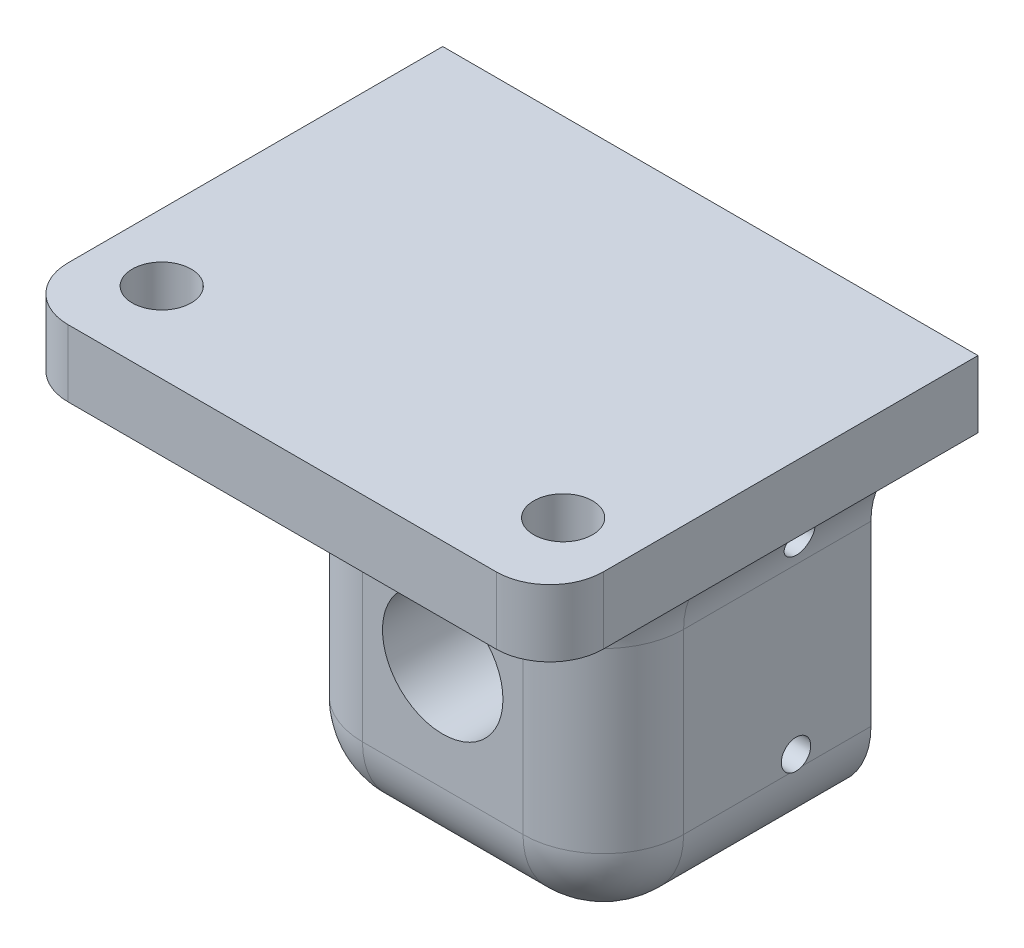
from build123d import *

# Parameters (mm, degrees)
ESQUISSE1_W                  = 40
ESQUISSE1_H                  = 34
BOSS_EXTRU_1_DEPTH           = 20
ESQUISSE2_W                  = 40
ESQUISSE2_H                  = 5
BOSS_EXTRU_3_DEPTH           = 20
ESQUISSE4_R                  = 4.5
ENL_V_MAT_EXTRU_1_DEPTH      = 34
ESQUISSE5_R                  = 8.1
ENL_V_MAT_EXTRU_2_DEPTH      = 12
ENL_V_MAT_EXTRU_3_DEPTH      = 34
CONG_3_R                     = 6
CONG_4_R                     = 6
ENL_V_MAT_EXTRU_4_DEPTH      = 54.972215074
ENL_V_MAT_EXTRU_4_DEPTH_BACK = 54.972215074
ESQUISSE7_R                  = 1.1
CONG_5_R                     = 6
ESQUISSE8_R                  = 2.2
ENL_V_MAT_EXTRU_5_DEPTH      = 54.301031939
BOSS_EXTRU_4_START           = -1
ESQUISSE10_R                 = 4.5
BOSS_EXTRU_4_DEPTH           = 1
ESQUISSE11_W                 = 40
ESQUISSE11_H                 = 8
ENL_V_MAT_EXTRU_6_DEPTH      = 54.301031939
CONG_6_R                     = 4


with BuildPart() as part:
    # Esquisse1 → Boss.-Extru.1 (new body)
    with BuildSketch(Plane.XY):
        Rectangle(ESQUISSE1_W, ESQUISSE1_H)
    extrude(amount=BOSS_EXTRU_1_DEPTH)

    # Esquisse2 → Boss.-Extru.3 (add)
    with BuildSketch(Plane.XY.offset(20)):
        with Locations((0, 14.5)):
            Rectangle(ESQUISSE2_W, ESQUISSE2_H)
    extrude(amount=BOSS_EXTRU_3_DEPTH)

    # Esquisse4 → Enlèv. mat.-Extru.1 (cut, through all)
    with BuildSketch(Plane.XY.offset(20)):
        with Locations((0, -3)):
            Circle(ESQUISSE4_R)
    extrude(amount=-ENL_V_MAT_EXTRU_1_DEPTH, mode=Mode.SUBTRACT)

    # Esquisse5 → Enlèv. mat.-Extru.2 (cut)
    with BuildSketch(Plane(origin=(0, 0, 0), x_dir=(-1, 0, 0), z_dir=(0, 0, -1))):
        with Locations((0, -3)):
            Circle(ESQUISSE5_R)
    extrude(amount=-ENL_V_MAT_EXTRU_2_DEPTH, mode=Mode.SUBTRACT)

    # Esquisse6 → Enlèv. mat.-Extru.3 (cut, through all)
    with BuildSketch(Plane.XY.offset(20)):
        Polygon((-20, 12), (-12, 5), (-12, -17), (-20, -17), align=None)
        Polygon((20, 12), (12, 5), (12, -17), (20, -17), align=None)
    extrude(amount=-ENL_V_MAT_EXTRU_3_DEPTH, mode=Mode.SUBTRACT)

    # Congé3
    cong_3_edges = [part.edges().sort_by_distance(p)[0] for p in [
        (12, -17, 10),
        (-12, -17, 10),
    ]]
    fillet(cong_3_edges, radius=CONG_3_R)

    # Congé4
    cong_4_edges = [part.edges().sort_by_distance(p)[0] for p in [
        (12, 5, 10),
        (-12, 5, 10),
    ]]
    fillet(cong_4_edges, radius=CONG_4_R)

    # Esquisse7 → Enlèv. mat.-Extru.4 (cut, two sides: drawn at the far end of the back side and taken through both)
    with BuildSketch(Plane.ZY.offset(12).offset(-ENL_V_MAT_EXTRU_4_DEPTH_BACK)):
        with Locations((5.6, 4)):
            Circle(ESQUISSE7_R)
        with Locations((5.6, -10)):
            Circle(ESQUISSE7_R)
    extrude(amount=ENL_V_MAT_EXTRU_4_DEPTH + ENL_V_MAT_EXTRU_4_DEPTH_BACK, mode=Mode.SUBTRACT)

    # Congé5
    cong_5_edges = [part.edges().sort_by_distance(p)[0] for p in [
        (-17.024486176, 9.396425404, 20),
        (-12.536202516, 4.756688335, 20),
        (-12, -4.36130468, 20),
        (-10.242640687, -15.242640687, 20),
        (0, -17, 20),
        (10.242640687, -15.242640687, 20),
        (12, -4.36130468, 20),
        (12.536202516, 4.756688335, 20),
        (17.024486176, 9.396425404, 20),
    ]]
    fillet(cong_5_edges, radius=CONG_5_R)

    # Esquisse8 → Enlèv. mat.-Extru.5 (cut, through all)
    with BuildSketch(Plane.XZ.offset(-12)):
        with Locations((-15, 26)):
            Circle(ESQUISSE8_R)
        with Locations((15, 26)):
            Circle(ESQUISSE8_R)
    extrude(amount=-ENL_V_MAT_EXTRU_5_DEPTH, mode=Mode.SUBTRACT)

    # Esquisse10 → Boss.-Extru.4 (add)
    with BuildSketch(Plane(origin=(0, 0, 12), x_dir=(-1, 0, 0), z_dir=(0, 0, -1)).offset(BOSS_EXTRU_4_START)):
        with Locations((0, -3)):
            Circle(ESQUISSE10_R)
    extrude(amount=BOSS_EXTRU_4_DEPTH)

    # Esquisse11 → Enlèv. mat.-Extru.6 (cut, through all)
    with BuildSketch(Plane.XZ.offset(-12)):
        with Locations((0, 36)):
            Rectangle(ESQUISSE11_W, ESQUISSE11_H)
    extrude(amount=-ENL_V_MAT_EXTRU_6_DEPTH, mode=Mode.SUBTRACT)

    # Congé6
    cong_6_edges = [part.edges().sort_by_distance(p)[0] for p in [
        (-20, 14.5, 32),
        (20, 14.5, 32),
    ]]
    fillet(cong_6_edges, radius=CONG_6_R)


solid = part.part
